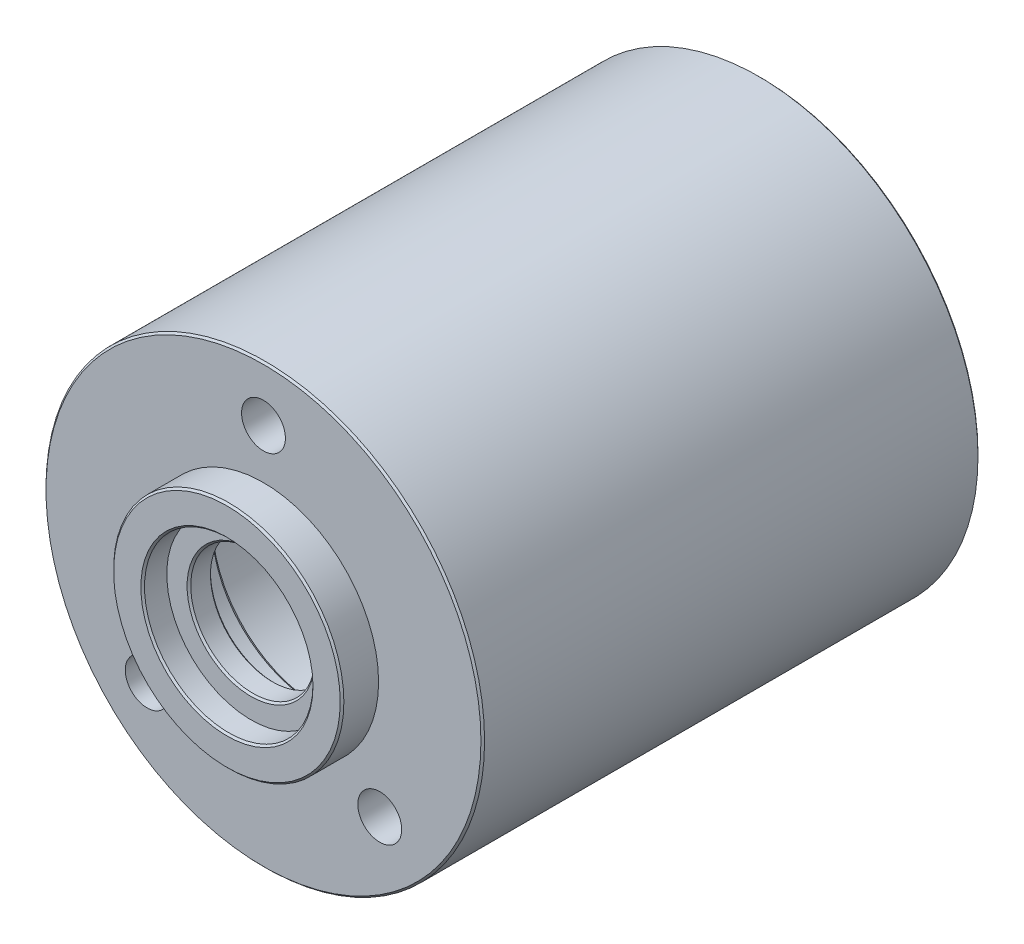
from build123d import *

# Parameters (mm, degrees)
SKETCH2_R          = 3
CUT_EXTRUDE1_DEPTH = 23
SKETCH3_R          = 3.25
SKETCH3_R_2        = 3.4
SKETCH3_R_3        = 3.697443322
CUT_EXTRUDE2_DEPTH = 23


with BuildPart() as part:
    # Sketch1 → Revolve1 (revolve)
    with BuildSketch(Plane(origin=(0, 0, 0), x_dir=(0, 0, -1), z_dir=(1, 0, 0))):
        Polygon((0.25, 15.75), (5, 15.75), (5, 29.75), (5.25, 30), (72.75, 30), (73, 29.75), (73, 28.85), (72, 28.85), (72, 26.85), (73, 26.85), (73, 14.85), (72.75, 14.6), (12.575, 14.6), (12, 14.025), (6.5, 14.025), (6.5, 8.75), (6.25, 8.5), (3.55, 8.5), (3.3, 8.75), (3.3, 11.525), (0.25, 11.525), (0, 11.775), (0, 15.5), align=None)
    revolve(axis=Axis((0, 0, 0), (0, 0, -1)))

    # Sketch2 → Cut-Extrude1 (cut)
    with BuildSketch(Plane.XY.offset(-5)):
        with Locations((15.909902577, -15.909902577)):
            Circle(SKETCH2_R)
        with Locations((-15.909902577, -15.909902577)):
            Circle(SKETCH2_R)
        with Locations((0, 22.5)):
            Circle(SKETCH2_R)
    extrude(amount=-CUT_EXTRUDE1_DEPTH, mode=Mode.SUBTRACT)

    # Sketch3 → Cut-Extrude2 (cut)
    with BuildSketch(Plane(origin=(0, 0, -73), x_dir=(-1, 0, 0), z_dir=(0, 0, -1))):
        with Locations((0, -19.763693495)):
            Circle(SKETCH3_R)
        with Locations((-18.796389484, -6.107317162)):
            Circle(SKETCH3_R)
        with Locations((-11.616807567, 15.989163909)):
            Circle(SKETCH3_R)
        with Locations((11.616807567, 15.989163909)):
            Circle(SKETCH3_R)
        with Locations((18.796389484, -6.107317162)):
            Circle(SKETCH3_R)
        with Locations((0, 21.2)):
            Circle(SKETCH3_R_2)
        with Locations((-12.45, -17.15)):
            Circle(SKETCH3_R_2)
        with Locations((12.45, -17.15)):
            Circle(SKETCH3_R_2)
        with Locations((-20.112696309, 6.901022254)):
            Circle(SKETCH3_R_3)
        with Locations((20.112696309, 6.901022254)):
            Circle(SKETCH3_R_3)
    extrude(amount=-CUT_EXTRUDE2_DEPTH, mode=Mode.SUBTRACT)


solid = part.part
